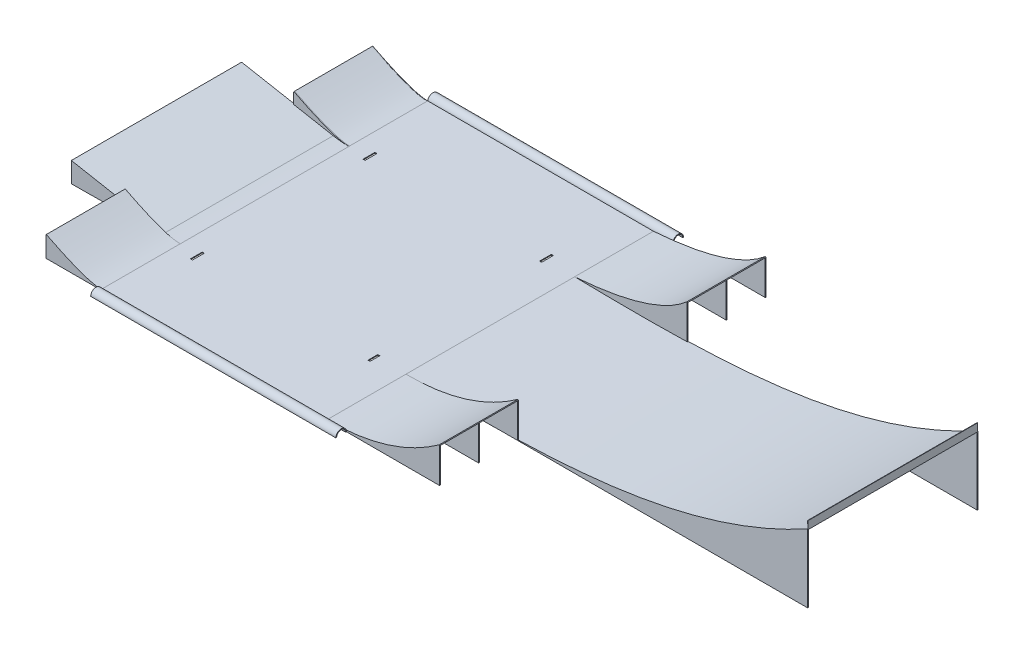
from build123d import *

# Parameters (mm, degrees)
BOSS_EXTRUDE1_DEPTH    = 432
BOSS_EXTRUDE3_DEPTH    = 200
BOSS_EXTRUDE4_DEPTH    = 200
BOSS_EXTRUDE6_DEPTH    = 1
LPATTERN1_COUNT        = 3
LPATTERN1_PITCH        = 99.5
BOSS_EXTRUDE7_DEPTH    = 1
LPATTERN2_COUNT        = 3
LPATTERN2_PITCH        = 99.5
BOSS_EXTRUDE11_DEPTH   = 1
LPATTERN3_COUNT        = 2
LPATTERN3_PITCH        = 432
BOSS_EXTRUDE13_START   = -1
BOSS_EXTRUDE13_DEPTH   = 2
LPATTERN4_COUNT        = 2
LPATTERN4_PITCH        = 108
LPATTERN5_COUNT        = 2
LPATTERN5_PITCH        = 108
BOSS_EXTRUDE15_DEPTH   = 1
BOSS_EXTRUDE18_DEPTH   = 1
LPATTERN7_COUNT        = 2
LPATTERN7_PITCH        = 831
LPATTERN8_COUNT        = 2
LPATTERN8_PITCH        = 432
BOSS_EXTRUDE20_DEPTH   = 625
BOSS_EXTRUDE20_2_DEPTH = 625
SKETCH16_W             = 5.2
SKETCH16_H             = 30
SKETCH16_H_2           = 25
CUT_EXTRUDE1_DEPTH     = 10


# Read off the part's stored shape, not the designer's step: Boss-Extrude4, Boss-Extrude13
with BuildPart() as part:
    # Sketch1 → Boss-Extrude1 (new body)
    with BuildSketch(Plane.XY):
        with BuildLine():
            Line((-623.7300751, -47.241686012), (-48.325235267, -47.241686012))
            add(Edge.make_bspline(
                [(-48.325235267, -47.241686012), (304.097240968, -53.293568868), (652.708136314, -53.214524342), (976.927199818, 124.879214384)],
                knots=[0, 0, 0, 0, 1, 1, 1, 1], degree=3))
            Line((976.927199818, 124.879214384), (976.890095954, 143.126265147))
            Line((976.890095954, 143.126265147), (977.890095954, 143.126265147))
            Line((977.890095954, 143.126265147), (977.890095954, 123.126265147))
            add(Edge.make_bspline(
                [(977.890095954, 123.126265147), (972.829557781, 120.346508295), (962.649646848, 114.848289962), (942.291868016, 104.221829789), (916.740714732, 91.562767464), (885.951212599, 77.35766219), (844.720873892, 59.683269817), (792.865342889, 39.887952752), (730.160444149, 19.556881887), (667.00923616, 2.397119984), (582.253989437, -16.590818249), (475.349704415, -33.660024084), (345.772556138, -45.498527785), (215.148651282, -50.712345947), (105.614933567, -51.218408546), (17.719966015, -50.328681251), (-26.33083989, -49.619661571), (-48.34240596, -49.241686012)],
                knots=[1.6238e-05, 1.6238e-05, 1.6238e-05, 1.6238e-05, 0.015640984, 0.03126573, 0.062515223, 0.093764715, 0.125014208, 0.187513193, 0.250012178, 0.312511163, 0.375010149, 0.500008119, 0.625006089, 0.750004059, 0.87500203, 0.937501015, 1, 1, 1, 1], degree=3))
            Line((-48.34240596, -49.241686012), (-623.913849283, -49.241686012))
            ThreePointArc((-623.913849283, -49.241686012), (-644.044205389, -48.318770078), (-664.005664892, -45.557765676))
            Line((-664.005664892, -45.557765676), (-899.273620227, -1.953427531))
            Line((-899.273620227, -1.953427531), (-899.273620227, 0.080633001))
            Line((-899.273620227, 0.080633001), (-663.821890708, -43.557765676))
            ThreePointArc((-663.821890708, -43.557765676), (-643.860431206, -46.318770078), (-623.7300751, -47.241686012))
        make_face()
    extrude(amount=BOSS_EXTRUDE1_DEPTH)

    # Sketch7 → Boss-Extrude3 (add)
    with BuildSketch(Plane(origin=(0, 0, 0), x_dir=(-1, 0, 0), z_dir=(0, 0, -1))):
        with BuildLine():
            Line((623.913849283, -49.241686012), (48.34240596, -49.241686012))
            add(Edge.make_bspline(
                [(48.34240596, -49.241686012), (-153.563383072, -34.398802109), (-238.549020828, 38.469825405)],
                knots=[0, 0, 0, 1, 1, 1], degree=2))
            Line((-238.549020828, 38.469825405), (-237.247193035, 39.988128536))
            add(Edge.make_bspline(
                [(48.415850635, -47.241686012), (46.325815428, -47.08791414), (42.133280497, -46.768630444), (33.857596748, -46.0948232), (23.644775197, -45.181102593), (11.623274549, -43.972019126), (-4.101672882, -42.209188942), (-23.184539906, -39.723410524), (-45.167584455, -36.289104722), (-66.233638213, -32.403807521), (-93.098790688, -26.622660695), (-124.386527424, -18.271013738), (-158.259880987, -6.453911794), (-183.427450705, 4.884238484), (-201.725473249, 14.844193994), (-214.533789963, 22.759613483), (-224.438178574, 29.719861155), (-231.917301672, 35.520176863), (-235.480864182, 38.473637821), (-237.247193035, 39.988128536)],
                knots=[0.000181545, 0.000181545, 0.000181545, 0.000181545, 0.015803709, 0.031425872, 0.062670199, 0.093914526, 0.125158852, 0.187647506, 0.250136159, 0.312624813, 0.375113466, 0.500090773, 0.62506808, 0.750045386, 0.81253404, 0.875022693, 0.937511347, 0.968755673, 1, 1, 1, 1], degree=3))
            Line((48.415850635, -47.241686012), (623.954656281, -47.241686012))
            add(Edge.make_bspline(
                [(763.939225041, 3.832734796), (762.894101919, 3.284910848), (760.794005083, 2.18777294), (756.654514915, 0.040008204), (751.547887888, -2.581648062), (745.542806427, -5.619169548), (737.694775017, -9.527258327), (728.184846677, -14.14497318), (717.252750039, -19.258723043), (706.801132194, -23.944798227), (693.506980341, -29.622628704), (678.093496654, -35.650528995), (664.291959859, -40.252564041), (654.224132822, -43.079462102), (647.162312046, -44.772827923), (640.592055893, -46.040314686), (635.530191463, -46.743007011), (631.729067364, -47.094414137), (629.007558737, -47.253174611), (626.397503705, -47.307558234), (624.778498637, -47.275318545), (623.954656281, -47.241686012)],
                knots=[-0.000510087, -0.000510087, -0.000510087, -0.000510087, 0.015122883, 0.030755853, 0.062021793, 0.093287733, 0.124553673, 0.187085554, 0.249617434, 0.312149315, 0.374681195, 0.499744956, 0.624808717, 0.687340598, 0.749872478, 0.812404359, 0.874936239, 0.906202179, 0.93746812, 0.96873406, 1, 1, 1, 1], degree=3))
            Line((763.939225041, 3.832734796), (764.867742401, 2.061335487))
            add(Edge.make_bspline(
                [(623.913849283, -49.241686012), (663.880558922, -50.873286654), (764.867742401, 2.061335487)],
                knots=[0, 0, 0, 1, 1, 1], degree=2))
        make_face()
    extrude(amount=BOSS_EXTRUDE3_DEPTH)

    # Boss-Extrude4 outline → Boss-Extrude4 (add)
    with BuildSketch(Plane.XY.offset(432)):
        with BuildLine():
            Line((-763.96166258, 3.844315958), (-764.867742401, 2.061335487))
            add(Edge.make_bspline(
                [(-764.867742401, 2.061335487), (-663.913849283, -49.241686012), (-623.913849283, -49.241686012)],
                knots=[0, 0, 0, 1, 1, 1], degree=2))
            Line((-623.913849283, -49.241686012), (-48.34240596, -49.241686012))
            add(Edge.make_bspline(
                [(-48.34240596, -49.241686012), (113.72391877, -50.727780266), (238.549020828, 38.469825405)],
                knots=[0, 0, 0, 1, 1, 1], degree=2))
            Line((238.549020828, 38.469825405), (237.386226644, 40.097065303))
            add(Edge.make_bspline(
                [(237.386226644, 40.097065303), (234.802037193, 38.250453461), (229.589414496, 34.6016729), (219.089334078, 27.554839652), (205.776812512, 19.182697072), (189.516440959, 9.844608002), (167.449871845, -1.665649556), (139.144399075, -14.288903056), (104.018562443, -26.61558335), (67.730328066, -36.12164935), (36.519147316, -41.692856079), (10.965425323, -44.739101371), (-8.490512633, -46.318295579), (-24.953131061, -47.046143555), (-38.257368877, -47.275643866), (-44.980687905, -47.272427766), (-48.333236486, -47.241686012)],
                knots=[-2.8288e-05, -2.8288e-05, -2.8288e-05, -2.8288e-05, 0.031222596, 0.06247348, 0.124975248, 0.187477016, 0.249978784, 0.37498232, 0.499985856, 0.624989392, 0.749992928, 0.812494696, 0.874996464, 0.937498232, 0.968749116, 1, 1, 1, 1], degree=3))
            Line((-48.333236486, -47.241686012), (-623.913849283, -47.241686012))
            add(Edge.make_bspline(
                [(-623.913849283, -47.241686012), (-624.322449483, -47.241686012), (-625.131932012, -47.233603205), (-626.812158926, -47.184963136), (-628.984609161, -47.063028551), (-631.719656512, -46.818249604), (-635.531614208, -46.359951517), (-640.607045268, -45.538727321), (-647.189613817, -44.15383408), (-654.26123892, -42.368371293), (-664.338791724, -39.452807056), (-678.14707933, -34.804410587), (-693.561381667, -28.81668816), (-706.853133957, -23.22301955), (-717.301509455, -18.626082348), (-728.228994547, -13.627491198), (-737.733990403, -9.127420498), (-745.577439397, -5.32646163), (-751.578787332, -2.375770772), (-756.682003652, 0.168044673), (-760.818713963, 2.250427666), (-762.91718939, 3.313532757), (-763.96166258, 3.844315958)],
                knots=[0, 0, 0, 0, 0.015625, 0.03125, 0.0625, 0.09375, 0.125, 0.1875, 0.25, 0.3125, 0.375, 0.5, 0.625, 0.6875, 0.75, 0.8125, 0.875, 0.90625, 0.9375, 0.96875, 0.984375, 1, 1, 1, 1], degree=3))
        make_face()
    extrude(amount=BOSS_EXTRUDE4_DEPTH)

    # Sketch9 → Boss-Extrude6 (add, symmetric)
    with BuildSketch(Plane(origin=(0, 0, 0), x_dir=(-1, 0, 0), z_dir=(0, 0, -1))):
        with BuildLine():
            Line((-238.549020828, -49.241686012), (48.415850635, -49.241686012))
            Line((48.415850635, -49.241686012), (48.415850635, -47.241686012))
            add(Edge.make_bspline(
                [(48.415850635, -47.241686012), (46.325815428, -47.08791414), (42.133280497, -46.768630444), (33.857596748, -46.0948232), (23.644775197, -45.181102593), (11.623274549, -43.972019126), (-4.101672882, -42.209188942), (-23.184539906, -39.723410524), (-45.167584455, -36.289104722), (-66.233638213, -32.403807521), (-93.098790688, -26.622660695), (-124.386527424, -18.271013738), (-158.259880987, -6.453911794), (-183.427450705, 4.884238484), (-201.725473249, 14.844193994), (-214.533789963, 22.759613483), (-224.438178574, 29.719861155), (-231.917301672, 35.520176863), (-235.480864182, 38.473637821), (-237.247193035, 39.988128536)],
                knots=[0.000181545, 0.000181545, 0.000181545, 0.000181545, 0.015803709, 0.031425872, 0.062670199, 0.093914526, 0.125158852, 0.187647506, 0.250136159, 0.312624813, 0.375113466, 0.500090773, 0.62506808, 0.750045386, 0.81253404, 0.875022693, 0.937511347, 0.968755673, 1, 1, 1, 1], degree=3))
            Line((-237.247193035, 39.988128536), (-238.549020828, 38.469825405))
            Line((-238.549020828, 38.469825405), (-238.549020828, -49.241686012))
        make_face()
    boss_extrude6 = extrude(amount=BOSS_EXTRUDE6_DEPTH, both=True)

    # LPattern1: Boss-Extrude6 ×3
    with Locations(*[(0, 0, -i * LPATTERN1_PITCH) for i in range(1, LPATTERN1_COUNT)]):
        add(boss_extrude6)

    # Sketch10 → Boss-Extrude7 (add, symmetric)
    with BuildSketch(Plane.XY.offset(432)):
        with BuildLine():
            Line((237.386226644, 40.097065303), (238.549020828, 38.469825405))
            Line((238.549020828, 38.469825405), (238.549020828, -49.241842908))
            Line((238.549020828, -49.241842908), (-48.316098582, -49.241842908))
            Line((-48.316098582, -49.241842908), (-48.316098582, -47.241842908))
            add(Edge.make_bspline(
                [(237.386226644, 40.097065303), (234.802037193, 38.250453461), (229.589414496, 34.6016729), (219.089334078, 27.554839652), (205.776812512, 19.182697072), (189.516440959, 9.844608002), (167.449871845, -1.665649556), (139.144399075, -14.288903056), (104.018562443, -26.61558335), (67.730328066, -36.12164935), (36.519147316, -41.692856079), (10.965425323, -44.739101371), (-8.490512633, -46.318295579), (-24.953131061, -47.046143555), (-38.251701405, -47.275546101), (-44.969231691, -47.272433161), (-48.316098582, -47.241842908)],
                knots=[-2.8288e-05, -2.8288e-05, -2.8288e-05, -2.8288e-05, 0.031222596, 0.06247348, 0.124975248, 0.187477016, 0.249978784, 0.37498232, 0.499985856, 0.624989392, 0.749992928, 0.812494696, 0.874996464, 0.937498232, 0.968749116, 0.99994675, 0.99994675, 0.99994675, 0.99994675], degree=3))
        make_face()
    boss_extrude7 = extrude(amount=BOSS_EXTRUDE7_DEPTH, both=True)

    # LPattern2: Boss-Extrude7 ×3
    with Locations(*[(0, 0, i * LPATTERN2_PITCH) for i in range(1, LPATTERN2_COUNT)]):
        add(boss_extrude7)

    # Sketch12 → Boss-Extrude11 (add, symmetric)
    with BuildSketch(Plane.XY.offset(432)):
        with BuildLine():
            Line((238.549020828, -47.344290559), (238.549020828, -49.241842908))
            Line((238.549020828, -49.241842908), (977.890095954, -49.241842908))
            Line((977.890095954, -49.241842908), (977.890095954, 123.126265147))
            Line((977.890095954, 123.126265147), (976.927199818, 124.879214384))
            add(Edge.make_bspline(
                [(976.927199818, 124.879214384), (741.068495609, -4.678122528), (492.301429294, -40.028589373), (238.549020828, -47.344290559)],
                knots=[0, 0, 0, 0, 0.727467107, 0.727467107, 0.727467107, 0.727467107], degree=3))
        make_face()
    boss_extrude11 = extrude(amount=BOSS_EXTRUDE11_DEPTH, both=True)

    # LPattern3: Boss-Extrude11 ×2
    with Locations(*[(0, 0, -i * LPATTERN3_PITCH) for i in range(1, LPATTERN3_COUNT)]):
        add(boss_extrude11)

    # Boss-Extrude13 outline → Boss-Extrude13 (add)
    with BuildSketch(Plane.XY.offset(216).offset(BOSS_EXTRUDE13_START)):
        with BuildLine():
            add(Edge.make_bspline(
                [(238.607199982, -49.343459904), (274.37399601, -48.312315077), (353.554544442, -44.787545188), (475.349704415, -33.660024084), (579.743813266, -16.99161335), (640.844283173, -3.458359662), (659.498664426, 1.060366875)],
                knots=[0.272533111, 0.272533111, 0.272533111, 0.272533111, 0.375010149, 0.500008119, 0.625006089, 0.680167508, 0.680167508, 0.680167508, 0.680167508], degree=3))
            Line((238.607199982, -49.343459904), (659.498665029, -49.343459904))
            Line((659.498665029, -49.343459904), (659.498664426, 1.060366875))
        make_face()
    boss_extrude13 = extrude(amount=BOSS_EXTRUDE13_DEPTH)

    # LPattern4: Boss-Extrude13 ×2
    with Locations(*[(0, 0, -i * LPATTERN4_PITCH) for i in range(1, LPATTERN4_COUNT)]):
        add(boss_extrude13)

    # LPattern5: Boss-Extrude13 ×2
    with Locations(*[(0, 0, i * LPATTERN5_PITCH) for i in range(1, LPATTERN5_COUNT)]):
        add(boss_extrude13)

    # Sketch14 → Boss-Extrude15 (add, symmetric)
    with BuildSketch(Plane.XY.offset(432)):
        with BuildLine():
            Line((-764.867742498, 2.061335536), (-764.867742498, -24.830024011))
            Line((-764.867742498, -24.830024011), (-899.273620227, 0.080633001))
            Line((-899.273620227, 0.080633001), (-899.273620227, -1.953427531))
            Line((-899.273620227, -1.953427531), (-899.273620227, -51.421994115))
            Line((-899.273620227, -51.421994115), (-624.121042493, -49.241338612))
            Line((-624.121042493, -49.241338612), (-624.121042493, -47.241338612))
            add(Edge.make_bspline(
                [(-624.121042493, -47.241338612), (-624.459675253, -47.240201698), (-625.203027385, -47.2315451), (-626.812158926, -47.184963136), (-628.984609161, -47.063028551), (-631.719656512, -46.818249604), (-635.531614208, -46.359951517), (-640.607045268, -45.538727321), (-647.189613817, -44.15383408), (-654.26123892, -42.368371293), (-664.338791724, -39.452807056), (-678.14707933, -34.804410587), (-693.561381667, -28.81668816), (-706.853133957, -23.22301955), (-717.301509455, -18.626082348), (-728.228994547, -13.627491198), (-737.733990403, -9.127420498), (-745.577439397, -5.32646163), (-751.578787332, -2.375770772), (-756.682003652, 0.168044673), (-760.818713963, 2.250427666), (-762.91718939, 3.313532757), (-763.96166258, 3.844315958)],
                knots=[0.00264456, 0.00264456, 0.00264456, 0.00264456, 0.015625, 0.03125, 0.0625, 0.09375, 0.125, 0.1875, 0.25, 0.3125, 0.375, 0.5, 0.625, 0.6875, 0.75, 0.8125, 0.875, 0.90625, 0.9375, 0.96875, 0.984375, 1, 1, 1, 1], degree=3))
            Line((-763.96166258, 3.844315958), (-764.867742498, 2.061335536))
        make_face()
    boss_extrude15 = extrude(amount=BOSS_EXTRUDE15_DEPTH, both=True)

    # Sketch15 → Boss-Extrude18 (add)
    with BuildSketch(Plane.XY.offset(632)):
        with BuildLine():
            Line((-763.96166258, 3.844315958), (-764.867742401, 2.061335487))
            Line((-764.867742401, 2.061335487), (-764.867742401, -49.241686012))
            Line((-764.867742401, -49.241686012), (-623.913849286, -49.241686012))
            Line((-623.913849286, -49.241686012), (-623.913849286, -47.241686012))
            add(Edge.make_bspline(
                [(-623.913849286, -47.241686012), (-624.322449483, -47.241686012), (-625.131932012, -47.233603205), (-626.812158926, -47.184963136), (-628.984609161, -47.063028551), (-631.719656512, -46.818249604), (-635.531614208, -46.359951517), (-640.607045268, -45.538727321), (-647.189613817, -44.15383408), (-654.26123892, -42.368371293), (-664.338791724, -39.452807056), (-678.14707933, -34.804410587), (-693.561381667, -28.81668816), (-706.853133957, -23.22301955), (-717.301509455, -18.626082348), (-728.228994547, -13.627491198), (-737.733990403, -9.127420498), (-745.577439397, -5.32646163), (-751.578787332, -2.375770772), (-756.682003652, 0.168044673), (-760.818713963, 2.250427666), (-762.91718939, 3.313532757), (-763.96166258, 3.844315958)],
                knots=[0, 0, 0, 0, 0.015625, 0.03125, 0.0625, 0.09375, 0.125, 0.1875, 0.25, 0.3125, 0.375, 0.5, 0.625, 0.6875, 0.75, 0.8125, 0.875, 0.90625, 0.9375, 0.96875, 0.984375, 1, 1, 1, 1], degree=3))
        make_face()
    boss_extrude18 = extrude(amount=-BOSS_EXTRUDE18_DEPTH)

    # LPattern7: Boss-Extrude18 ×2
    with Locations(*[(0, 0, -i * LPATTERN7_PITCH) for i in range(1, LPATTERN7_COUNT)]):
        add(boss_extrude18)

    # LPattern8: Boss-Extrude15 ×2
    with Locations(*[(0, 0, -i * LPATTERN8_PITCH) for i in range(1, LPATTERN8_COUNT)]):
        add(boss_extrude15)

    # Sketch16 → Cut-Extrude1 (cut)
    with BuildSketch(Plane(origin=(0, -47.241686012, 0), x_dir=(1, 0, 0), z_dir=(0, 1, 0))):
        with Locations((-574.965253458, -436)):
            Rectangle(SKETCH16_W, SKETCH16_H)
        with Locations((-574.965253458, 4)):
            Rectangle(SKETCH16_W, SKETCH16_H)
        with Locations((-124.965253458, -436)):
            Rectangle(SKETCH16_W, SKETCH16_H_2)
        with Locations((-124.965253458, 4)):
            Rectangle(SKETCH16_W, SKETCH16_H)
    extrude(amount=-CUT_EXTRUDE1_DEPTH, mode=Mode.SUBTRACT)


with BuildPart() as body_2:
    # Sketch11 → Boss-Extrude20 (new body)
    with BuildSketch(Plane(origin=(-623.913849283, 0, 0), x_dir=(0, 0, -1), z_dir=(1, 0, 0))):
        with BuildLine():
            Line((-632, -49.241686012), (-634, -49.241686012))
            ThreePointArc((-634, -49.241686012), (-645.5, -37.741686012), (-657, -49.241686012))
            Line((-657, -49.241686012), (-659, -49.241686012))
            ThreePointArc((-659, -49.241686012), (-645.5, -35.741686012), (-632, -49.241686012))
        make_face()
    extrude(amount=BOSS_EXTRUDE20_DEPTH)


with BuildPart() as body_3:
    # Sketch11 → Boss-Extrude20 2 (new body)
    with BuildSketch(Plane(origin=(-623.913849283, 0, 0), x_dir=(0, 0, -1), z_dir=(1, 0, 0))):
        with BuildLine():
            Line((202, -49.241686012), (200, -49.241686012))
            ThreePointArc((200, -49.241686012), (213.5, -35.741686012), (227, -49.241686012))
            Line((227, -49.241686012), (225, -49.241686012))
            ThreePointArc((225, -49.241686012), (213.5, -37.741686012), (202, -49.241686012))
        make_face()
    extrude(amount=BOSS_EXTRUDE20_2_DEPTH)


solid = Compound([part.part, body_2.part, body_3.part])
